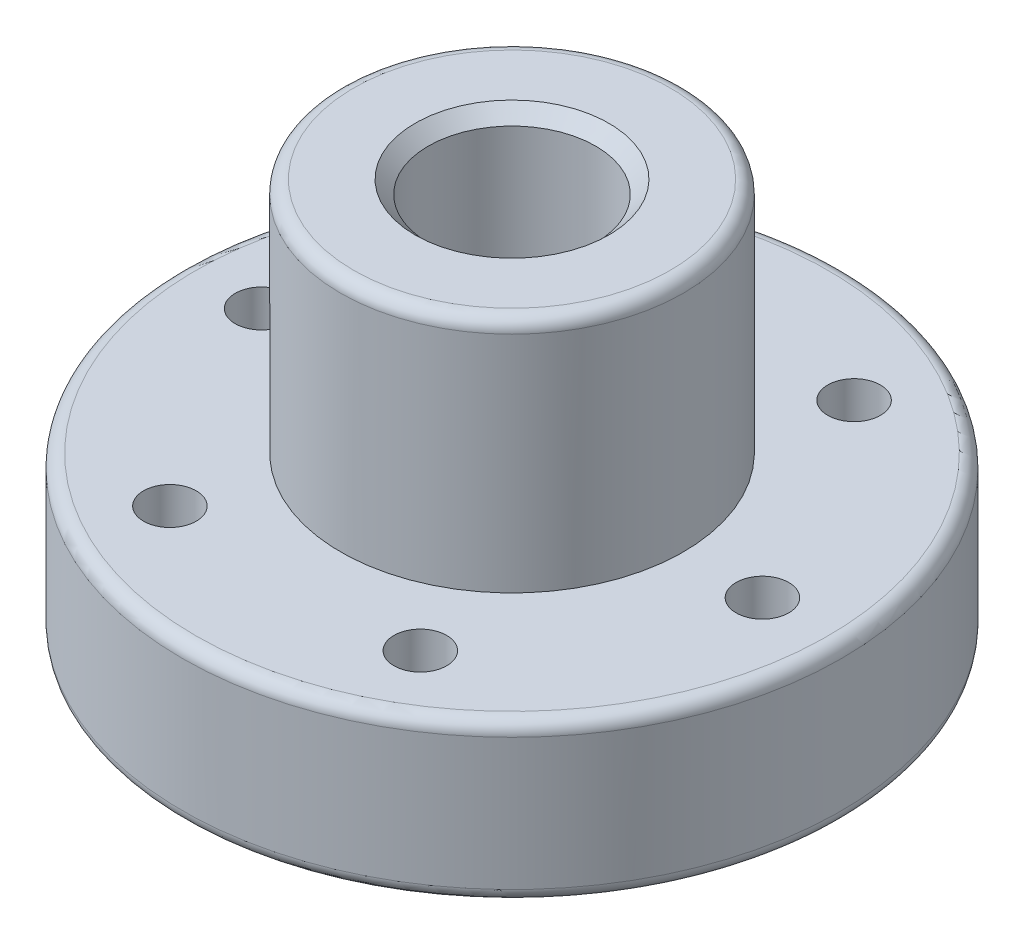
from build123d import *

# Parameters (mm, degrees)
ESQUISSE3_R             = 1
ENL_V_MAT_EXTRU_1_DEPTH = 20.836834425
CONG_1_R                = 0.5
CHANFREIN1_SIZE         = 0.5


with BuildPart() as part:
    # Esquisse1 → Révolution2 (revolve)
    with BuildSketch(Plane.XY):
        Polygon((6.5, 15), (6.5, 6), (12.5, 6), (12.5, 0), (3.175, 0), (3.175, 15), align=None)
    revolve(axis=Axis((0, 0, 0), (0, 1, 0)))

    # Esquisse3 → Enlèv. mat.-Extru.1 (cut, through all)
    with BuildSketch(Plane(origin=(0, 6, 0), x_dir=(1, 0, 0), z_dir=(0, 1, 0))):
        with Locations((9.5, 0)):
            Circle(ESQUISSE3_R)
        with Locations((4.75, -8.227241336)):
            Circle(ESQUISSE3_R)
        with Locations((-4.75, -8.227241336)):
            Circle(ESQUISSE3_R)
        with Locations((-9.5, 0)):
            Circle(ESQUISSE3_R)
        with Locations((-4.75, 8.227241336)):
            Circle(ESQUISSE3_R)
        with Locations((4.75, 8.227241336)):
            Circle(ESQUISSE3_R)
    extrude(amount=-ENL_V_MAT_EXTRU_1_DEPTH, mode=Mode.SUBTRACT)

    # Congé1
    cong_1_edges = [part.edges().sort_by_distance(p)[0] for p in [
        (-6.5, 15, 0),
        (-12.5, 0, 0),
        (-12.5, 6, 0),
    ]]
    fillet(cong_1_edges, radius=CONG_1_R)

    # Chanfrein1
    chanfrein1_edges = [part.edges().sort_by_distance(p)[0] for p in [
        (-3.175, 0, 0),
        (-3.175, 15, 0),
    ]]
    chamfer(chanfrein1_edges, length=CHANFREIN1_SIZE)


solid = part.part
